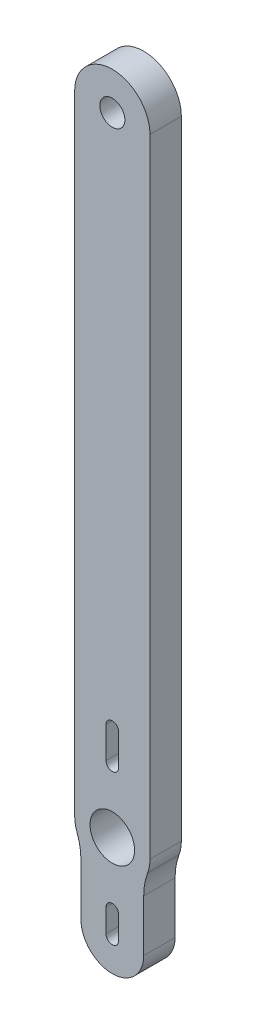
from build123d import *

# Parameters (mm, degrees)
MODEL_R             = 3.55
MODEL_R_2           = 2
BOSS_EXTRUDE1_DEPTH = 5


with BuildPart() as part:
    # Model → Boss-Extrude1 (new body)
    with BuildSketch(Plane.XY):
        with BuildLine():
            Line((-6, 0), (-6, 100))
            ThreePointArc((-6, 100), (0, 106), (6, 100))
            Line((6, 100), (6, 0))
            ThreePointArc((6, 0), (5.905505906, -1.060660172), (5.625, -2.087911636))
            ThreePointArc((5.625, -2.087911636), (5.157490157, -3.79999741), (5, -5.567764363))
            Line((5, -5.567764363), (5, -13.8))
            ThreePointArc((5, -13.8), (0, -18.8), (-5, -13.8))
            Line((-5, -13.8), (-5, -5.567764363))
            ThreePointArc((-5, -5.567764363), (-5.157490157, -3.79999741), (-5.625, -2.087911636))
            ThreePointArc((-5.625, -2.087911636), (-5.905505906, -1.060660172), (-6, 0))
        make_face()
        Circle(MODEL_R, mode=Mode.SUBTRACT)
        with Locations((0, 100)):
            Circle(MODEL_R_2, mode=Mode.SUBTRACT)
        with BuildLine():
            Line((-1, -10.1), (-1, -13.8))
            ThreePointArc((-1, -13.8), (0, -14.8), (1, -13.8))
            Line((1, -13.8), (1, -10.1))
            ThreePointArc((1, -10.1), (0, -9.1), (-1, -10.1))
        make_face(mode=Mode.SUBTRACT)
        with BuildLine():
            Line((-1, 15.1), (-1, 10.1))
            ThreePointArc((-1, 10.1), (0, 9.1), (1, 10.1))
            Line((1, 10.1), (1, 15.1))
            ThreePointArc((1, 15.1), (0, 16.1), (-1, 15.1))
        make_face(mode=Mode.SUBTRACT)
    extrude(amount=BOSS_EXTRUDE1_DEPTH)


solid = part.part
